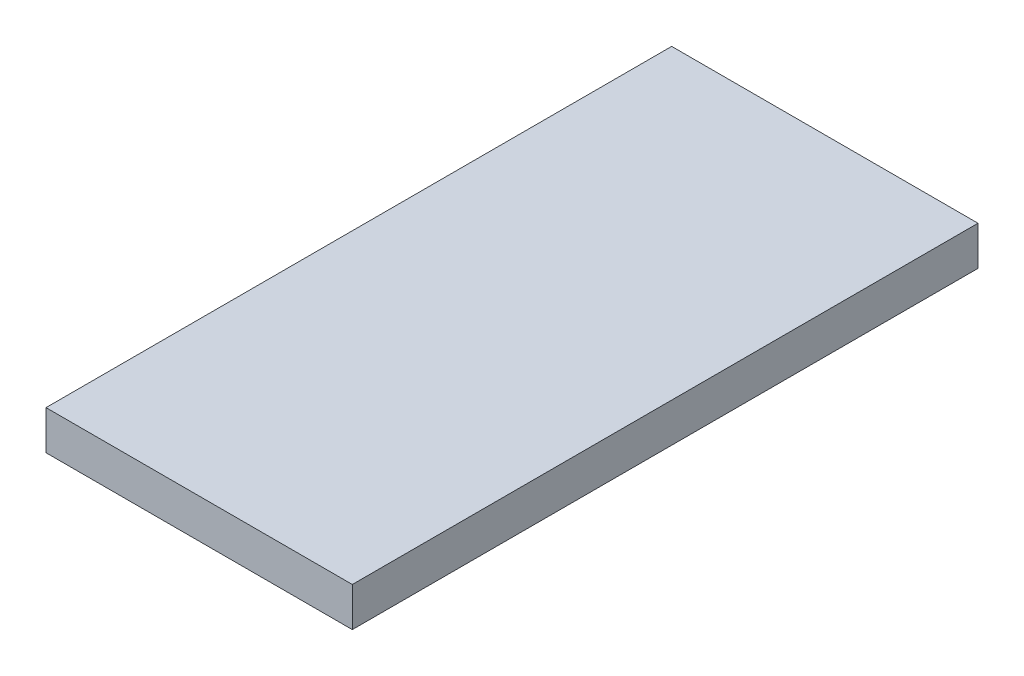
from build123d import *

# Parameters (mm, degrees)
SKETCH1_W           = 149.225
SKETCH1_H           = 304.8
BOSS_EXTRUDE1_DEPTH = 19.05


with BuildPart() as part:
    # Sketch1 → Boss-Extrude1 (new body)
    with BuildSketch(Plane(origin=(0, 0, 0), x_dir=(1, 0, 0), z_dir=(0, 1, 0))):
        Rectangle(SKETCH1_W, SKETCH1_H)
    extrude(amount=BOSS_EXTRUDE1_DEPTH)


solid = part.part
